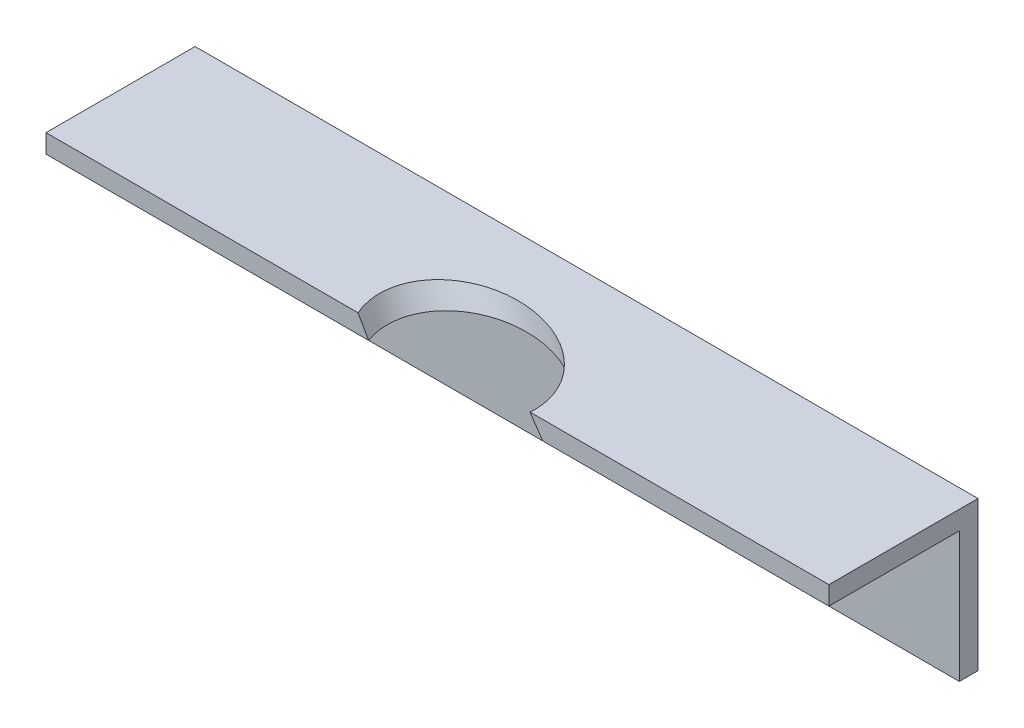
from build123d import *

# Parameters (mm, degrees)
BOSS_EXTRUDE1_DEPTH = 133.35
SKETCH5_R           = 3.57124
CUT_EXTRUDE1_DEPTH  = 139.103376269


with BuildPart() as part:
    # Sketch1 → Boss-Extrude1 (new body)
    with BuildSketch(Plane(origin=(0, 0, 0), x_dir=(0, 0, -1), z_dir=(1, 0, 0))):
        Polygon((0, 0), (0, 25.4), (-25.4, 25.4), (-25.4, 22.225), (-3.175, 22.225), (-3.175, 0), align=None)
    extrude(amount=BOSS_EXTRUDE1_DEPTH)

    # Cut-Sweep1: read off the stored shape, not the designer's step
    # Cut-Sweep1: loft between two sections, ruled curve by curve
    cut_sweep1_from = [
        Edge.make_bspline([(313.868695545, -367.401209175, 110.125818187), (314.822976006, -368.561544306, 135.48134956), (334.440699372, -352.427576105, 135.48134956), (333.486418911, -351.267240974, 110.125818187), (332.53213845, -350.106905843, 84.770286815), (312.914415084, -366.240874045, 84.770286815), (313.868695545, -367.401209175, 110.125818187)], [0, 0, 0, 0, 0.5, 0.5, 0.5, 1, 1, 1, 1], 3, [1, 0.333333333, 0.333333333, 1, 0.333333333, 0.333333333, 1]),
    ]
    cut_sweep1_to = [
        Edge.make_bspline([(-146.659751189, 323.693531683, -46.998545783), (-145.705470727, 322.533196552, -21.64301441), (-126.087747361, 338.667164754, -21.64301441), (-127.042027823, 339.827499885, -46.998545783), (-127.996308284, 340.987835016, -72.354077155), (-147.61403165, 324.853866814, -72.354077155), (-146.659751189, 323.693531683, -46.998545783)], [0, 0, 0, 0, 0.5, 0.5, 0.5, 1, 1, 1, 1], 3, [1, 0.333333333, 0.333333333, 1, 0.333333333, 0.333333333, 1]),
    ]
    cut_sweep1 = Solid(Shell([*[Face.make_surface_from_curves(cut_sweep1_from[k], cut_sweep1_to[k]) for k in range(1)], Face(Wire(cut_sweep1_from)), Face(Wire(cut_sweep1_to))]))
    add(cut_sweep1, mode=Mode.SUBTRACT)

    # Sketch5 → Cut-Extrude1 (cut, through all)
    with BuildSketch(Plane(origin=(0, 0, 0), x_dir=(-1, 0, 0), z_dir=(0, 0, -1))):
        with Locations((-107.95, 8.89)):
            Circle(SKETCH5_R)
        with Locations((-25.4, 8.89)):
            Circle(SKETCH5_R)
    extrude(amount=-CUT_EXTRUDE1_DEPTH, mode=Mode.SUBTRACT)


solid = part.part
